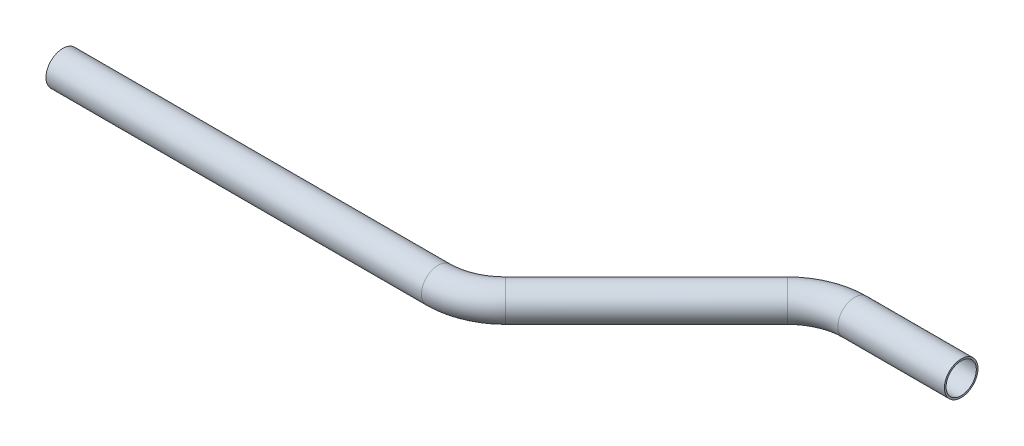
from build123d import *

# Parameters (mm, degrees)
SKETCH2_R   = 6.35
SKETCH2_R_2 = 5.715


with BuildPart() as part:
    # Sweep1: sweep along a path in Sketch1
    with BuildLine(Plane(origin=(0, 0, 0), x_dir=(1, 0, 0), z_dir=(0, 1, 0))) as sweep1_path:
        Line((0, 0), (141.878975516, 0))
        ThreePointArc((141.878975516, 0), (151.599134698, 1.933459874), (159.839487758, 7.439487758))
        Line((159.839487758, 7.439487758), (213.116653654, 60.716653654))
        ThreePointArc((213.116653654, 60.716653654), (221.357006714, 66.222681537), (231.077165896, 68.156141412))
        Line((231.077165896, 68.156141412), (271.356141412, 68.156141412))
    # Sketch2 → Sweep1 (sweep)
    with BuildSketch(Plane(origin=(0, 0, 0), x_dir=(0, 0, -1), z_dir=(1, 0, 0))):
        Circle(SKETCH2_R)
        Circle(SKETCH2_R_2, mode=Mode.SUBTRACT)
    sweep(path=sweep1_path.line)


solid = part.part
